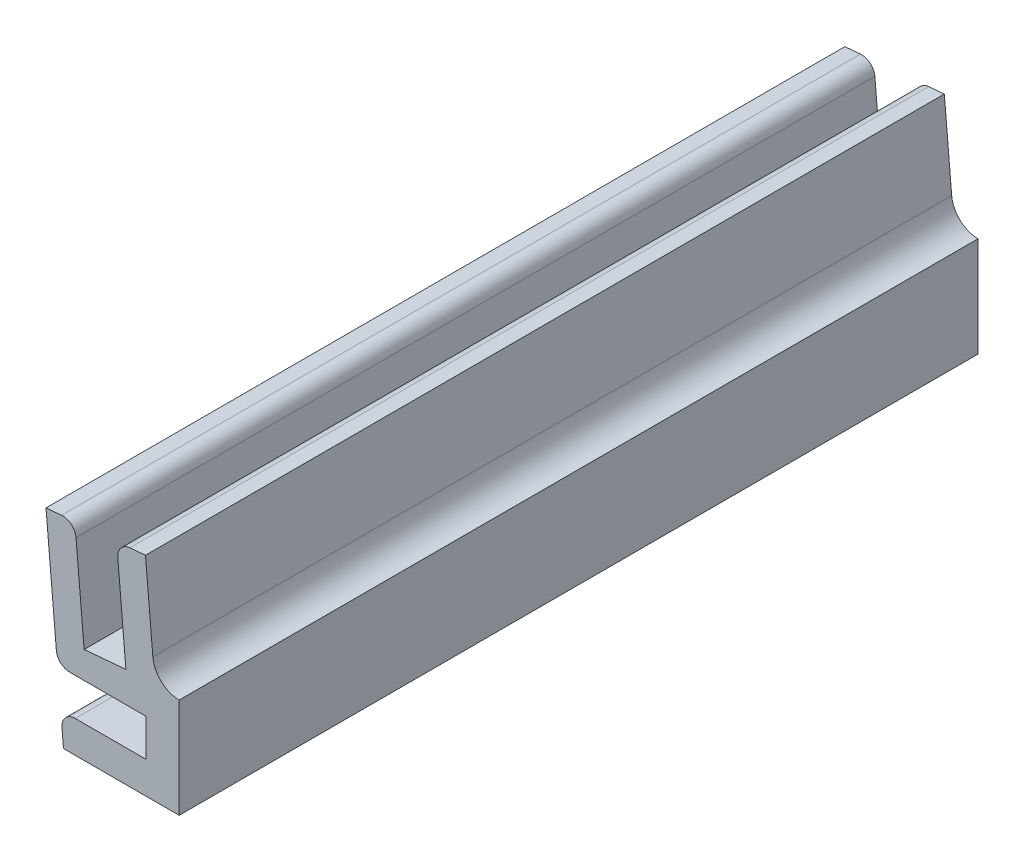
from build123d import *

# Parameters (mm, degrees)
BOSS_EXTRUDE1_DEPTH = 38.1
CUT_EXTRUDE1_DEPTH  = 80.768105782
FILLET1_R           = 2.54
FILLET2_R           = 1.27


with BuildPart() as part:
    # Sketch1 → Boss-Extrude1 (new, symmetric)
    with BuildSketch(Plane.XY):
        Polygon((0, 0), (-11.03334096, 0), (-12.7, 19.05), (-3.211245501, 19.88015845), (-2.305286527, 9.525), (0, 9.525), align=None)
    extrude(amount=BOSS_EXTRUDE1_DEPTH, both=True)

    # Sketch2 → Cut-Extrude1 (cut, through all)
    with BuildSketch(Plane.XY.offset(38.1)):
        Polygon((-5.963233354, 19.63939071), (-5.077731008, 9.518052578), (-9.0625098, 9.169429607), (-9.948012147, 19.290767739), align=None)
        Polygon((-11.611116094, 6.604), (-3.175, 6.604), (-3.175, 3.048), (-11.300006406, 3.048), align=None)
    extrude(amount=-CUT_EXTRUDE1_DEPTH, mode=Mode.SUBTRACT)

    # Fillet1
    # the kernel refuses this fillet: 2.54 mm, written as the material it adds along each edge
    with BuildSketch(Plane(origin=(-2.305286527, 9.525, -38.1), x_dir=(1, 0, 0), z_dir=(0, 0, 1))) as fillet1_piece_1_section:
        with BuildLine():
            CenterArc((FILLET1_R * 0.916331174017, FILLET1_R), FILLET1_R, 185, 85)
            Line((-FILLET1_R * 0.0798635240743, FILLET1_R * 0.912844257252), (0, 0))
            Line((0, 0), (FILLET1_R * 0.916331174017, 0))
        make_face()
    fillet1_piece_1 = extrude(amount=76.2, mode=Mode.PRIVATE)
    fillet1_piece_1 = split(fillet1_piece_1, bisect_by=Plane(origin=(0, 10.045448834, 0), z_dir=(-1, 0, 0)), keep=Keep.TOP, mode=Mode.PRIVATE)
    add(fillet1_piece_1)

    # Fillet2
    fillet2_edges = [part.edges().sort_by_distance(p)[0] for p in [
        (-9.948012147, 19.290767739, 0),
        (-5.963233354, 19.63939071, 0),
        (-11.300006406, 3.048, 0),
        (-11.611116094, 6.604, 0),
    ]]
    fillet(fillet2_edges, radius=FILLET2_R)


solid = part.part
